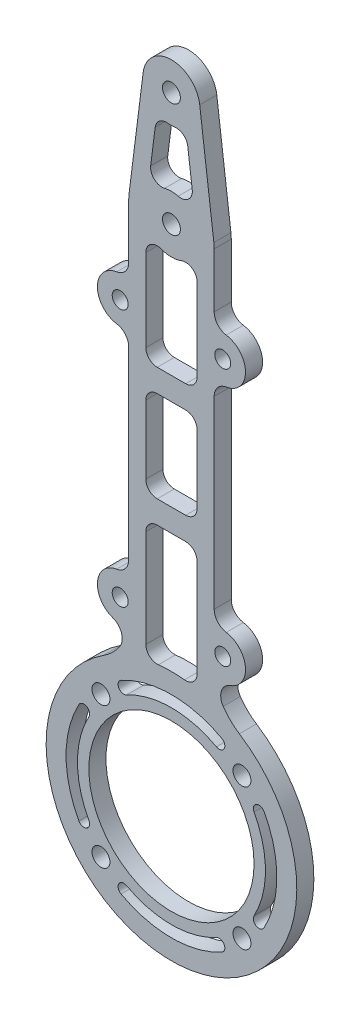
from build123d import *

# Parameters (mm, degrees)
SKETCH_1_R          = 1.575
SKETCH_1_R_2        = 14.5
EXTRUDE_1_DEPTH     = 3
CUT_EXTRUDE_START   = -3
CUT_EXTRUDE_1_DEPTH = 3
SKETCH_3_W          = 9
SKETCH_3_H          = 4
EXTRUDE_2_DEPTH     = 3
SKETCH_4_R          = 4
SKETCH_4_R_2        = 1.4
EXTRUDE_3_DEPTH     = 3
FILLET_1_R          = 2
FILLET_2_R          = 10
FILLET_3_R          = 2.5
CUT_EXTRUDE_2_DEPTH = 10


with BuildPart() as part:
    # 草图1 → 凸台-拉伸1 (new body)
    with BuildSketch(Plane.XY):
        with BuildLine():
            ThreePointArc((7.5, 0), (7.485279444, 0.469671844), (7.441175562, 0.9375))
            Line((7.441175562, 0.9375), (4.960783708, 20.625))
            ThreePointArc((4.960783708, 20.625), (0, 25), (-4.960783708, 20.625))
            Line((-4.960783708, 20.625), (-7.441175562, 0.9375))
            ThreePointArc((-7.441175562, 0.9375), (-7.485279444, 0.469671844), (-7.5, 0))
            Line((-7.5, 0), (-7.5, -69.31788212))
            ThreePointArc((-7.5, -69.31788212), (0, -112), (7.5, -69.31788212))
            Line((7.5, -69.31788212), (7.5, 0))
        make_face()
        with Locations((-12.374368671, -102.374368671)):
            Circle(SKETCH_1_R, mode=Mode.SUBTRACT)
        with Locations((-12.374368671, -77.625631329)):
            Circle(SKETCH_1_R, mode=Mode.SUBTRACT)
        with Locations((0, -90)):
            Circle(SKETCH_1_R_2, mode=Mode.SUBTRACT)
        with Locations((12.374368671, -102.374368671)):
            Circle(SKETCH_1_R, mode=Mode.SUBTRACT)
        with Locations((12.374368671, -77.625631329)):
            Circle(SKETCH_1_R, mode=Mode.SUBTRACT)
        Circle(SKETCH_1_R, mode=Mode.SUBTRACT)
        with Locations((0, 20)):
            Circle(SKETCH_1_R, mode=Mode.SUBTRACT)
    extrude(amount=EXTRUDE_1_DEPTH)

    # 草图2 → 切除-拉伸1 (cut)
    with BuildSketch(Plane.XY.offset(3).offset(CUT_EXTRUDE_START)):
        with BuildLine():
            Line((0, -68), (0, -5))
            ThreePointArc((0, -5), (-2.655442773, -4.236581603), (-4.5, -2.179449472))
            Line((-4.5, -2.179449472), (-4.5, -68.465144533))
            ThreePointArc((-4.5, -68.465144533), (-2.261988032, -68.116595097), (0, -68))
        make_face()
        with BuildLine():
            ThreePointArc((4.5, -2.179449472), (2.655442773, -4.236581603), (0, -5))
            Line((0, -5), (0, -68))
            ThreePointArc((0, -68), (2.261988032, -68.116595097), (4.5, -68.465144533))
            Line((4.5, -68.465144533), (4.5, -2.179449472))
        make_face()
        with BuildLine():
            Line((-2.557135445, 15.70336663), (-4.192274153, 2.724855487))
            ThreePointArc((-4.192274153, 2.724855487), (0, 5), (4.192274153, 2.724855487))
            Line((4.192274153, 2.724855487), (2.557135445, 15.70336663))
            ThreePointArc((2.557135445, 15.70336663), (0, 15), (-2.557135445, 15.70336663))
        make_face()
    extrude(amount=CUT_EXTRUDE_1_DEPTH, mode=Mode.SUBTRACT)

    # 草图3 → 凸台-拉伸2 (add)
    with BuildSketch(Plane.XY.offset(3)):
        with Locations((0, -45)):
            Rectangle(SKETCH_3_W, SKETCH_3_H)
        with Locations((0, -25)):
            Rectangle(SKETCH_3_W, SKETCH_3_H)
    extrude(amount=-EXTRUDE_2_DEPTH)

    # 草图4 → 凸台-拉伸3 (add)
    # profile 1 of 4: a face of its own
    with BuildSketch(Plane.XY.offset(3)):
        with Locations((-9, -16)):
            Circle(SKETCH_4_R)
        with Locations((-9, -16)):
            Circle(SKETCH_4_R_2, mode=Mode.SUBTRACT)
    # profile 2 of 4: a face of its own
    with BuildSketch(Plane.XY.offset(3)):
        with Locations((-9, -61.2)):
            Circle(SKETCH_4_R)
        with Locations((-9, -61.2)):
            Circle(SKETCH_4_R_2, mode=Mode.SUBTRACT)
    # profile 3 of 4: a face of its own
    with BuildSketch(Plane.XY.offset(3)):
        with Locations((9, -61.2)):
            Circle(SKETCH_4_R)
        with Locations((9, -61.2)):
            Circle(SKETCH_4_R_2, mode=Mode.SUBTRACT)
    # profile 4 of 4: a face of its own
    with BuildSketch(Plane.XY.offset(3)):
        with Locations((9, -16)):
            Circle(SKETCH_4_R)
        with Locations((9, -16)):
            Circle(SKETCH_4_R_2, mode=Mode.SUBTRACT)
    extrude(amount=-EXTRUDE_3_DEPTH)

    # 圆角1
    fillet_1_edges = [part.edges().sort_by_distance(p)[0] for p in [
        (-4.5, -27, 1.5),
        (-4.5, -23, 1.5),
        (4.5, -23, 1.5),
        (4.5, -27, 1.5),
        (-2.557135445, 15.70336663, 1.5),
        (2.557135445, 15.70336663, 1.5),
        (4.192274153, 2.724855487, 1.5),
        (-4.192274153, 2.724855487, 1.5),
        (4.5, -68.465144533, 1.5),
        (-4.5, -68.465144533, 1.5),
        (-4.5, -2.179449472, 1.5),
        (4.5, -2.179449472, 1.5),
        (-4.5, -47, 1.5),
        (-4.5, -43, 1.5),
        (4.5, -43, 1.5),
        (4.5, -47, 1.5),
    ]]
    fillet(fillet_1_edges, radius=FILLET_1_R)

    # 圆角2
    # the kernel refuses this fillet: 10 mm, written as the material it adds along each edge
    with BuildSketch(Plane(origin=(-7.5, -69.31788212, 0), x_dir=(-0.8959663420766752, -0.44412195832422213, 0), z_dir=(0, 0, 1))) as fillet_2_piece_1:
        with BuildLine():
            CenterArc((6.0520135, -9.936998269), FILLET_2_R, 96.434905118, 46.795533404)
            Line((-1.958481407, -3.951017033), (-2.118691305, -3.831297409))
            ThreePointArc((-2.118691305, -3.831297409), (-1.158433972, -1.886684125), (-0.179193268, 0.088824392))
            Line((-0.179193268, 0.088824392), (0.022414865, 0.198739965))
            ThreePointArc((0.022414865, 0.198739965), (2.46563513, 0.061396191), (4.908855394, 0.198739965))
            Line((4.908855394, 0.198739965), (4.931270259, 0))
        make_face()
    extrude(amount=3)
    with BuildSketch(Plane(origin=(7.5, -69.31788212, 0), x_dir=(0.8959663420766733, -0.44412195832422613, 0), z_dir=(0, 0, 1))) as fillet_2_piece_2:
        with BuildLine():
            CenterArc((6.0520135, 9.936998269), FILLET_2_R, 216.769561479, 46.795533404)
            Line((-1.958481407, 3.951017033), (-2.118691305, 3.831297409))
            ThreePointArc((-2.118691305, 3.831297409), (-1.158433972, 1.886684125), (-0.179193268, -0.088824392))
            Line((-0.179193268, -0.088824392), (0.022414865, -0.198739965))
            ThreePointArc((0.022414865, -0.198739965), (2.46563513, -0.061396191), (4.908855394, -0.198739965))
            Line((4.908855394, -0.198739965), (4.931270259, 0))
        make_face()
    extrude(amount=3)

    # 圆角3
    fillet_3_edges = [part.edges().sort_by_distance(p)[0] for p in [
        (-7.5, -64.908099244, 1.5),
        (-7.5, -57.491900756, 1.5),
        (7.5, -64.908099244, 1.5),
        (7.5, -57.491900756, 1.5),
        (-7.5, -12.291900756, 1.5),
        (-7.5, -19.708099244, 1.5),
        (7.5, -12.291900756, 1.5),
        (7.5, -19.708099244, 1.5),
    ]]
    fillet(fillet_3_edges, radius=FILLET_3_R)

    # 草图5 → 切除-拉伸2 (cut)
    with BuildSketch(Plane.XY.offset(3)):
        with BuildLine():
            ThreePointArc((8.848308271, -73.753232914), (0, -71.5), (-8.848308271, -73.753232914))
            ThreePointArc((-8.848308271, -73.753232914), (-9.248224964, -75.109723474), (-7.891734404, -75.509640167))
            ThreePointArc((-7.891734404, -75.509640167), (1.6e-08, -73.5), (7.891734432, -75.509640182))
            ThreePointArc((7.891734432, -75.509640182), (9.248224971, -75.10972346), (8.848308271, -73.753232914))
        make_face()
        with BuildLine():
            ThreePointArc((16.246767086, -81.151691729), (14.890276526, -80.751775036), (14.490359833, -82.108265596))
            ThreePointArc((14.490359833, -82.108265596), (16.5, -90.000000016), (14.490359818, -97.891734432))
            ThreePointArc((14.490359818, -97.891734432), (14.89027654, -99.248224971), (16.246767086, -98.848308271))
            ThreePointArc((16.246767086, -98.848308271), (18.5, -90), (16.246767086, -81.151691729))
        make_face()
        with BuildLine():
            ThreePointArc((8.848308271, -106.246767086), (9.248224964, -104.890276526), (7.891734404, -104.490359833))
            ThreePointArc((7.891734404, -104.490359833), (-1.6e-08, -106.5), (-7.891734432, -104.490359818))
            ThreePointArc((-7.891734432, -104.490359818), (-9.248224971, -104.89027654), (-8.848308271, -106.246767086))
            ThreePointArc((-8.848308271, -106.246767086), (0, -108.5), (8.848308271, -106.246767086))
        make_face()
        with BuildLine():
            ThreePointArc((-16.246767086, -98.848308271), (-14.890276526, -99.248224964), (-14.490359833, -97.891734404))
            ThreePointArc((-14.490359833, -97.891734404), (-16.5, -89.999999984), (-14.490359818, -82.108265568))
            ThreePointArc((-14.490359818, -82.108265568), (-14.89027654, -80.751775029), (-16.246767086, -81.151691729))
            ThreePointArc((-16.246767086, -81.151691729), (-18.5, -90), (-16.246767086, -98.848308271))
        make_face()
    extrude(amount=-CUT_EXTRUDE_2_DEPTH, mode=Mode.SUBTRACT)


solid = part.part
